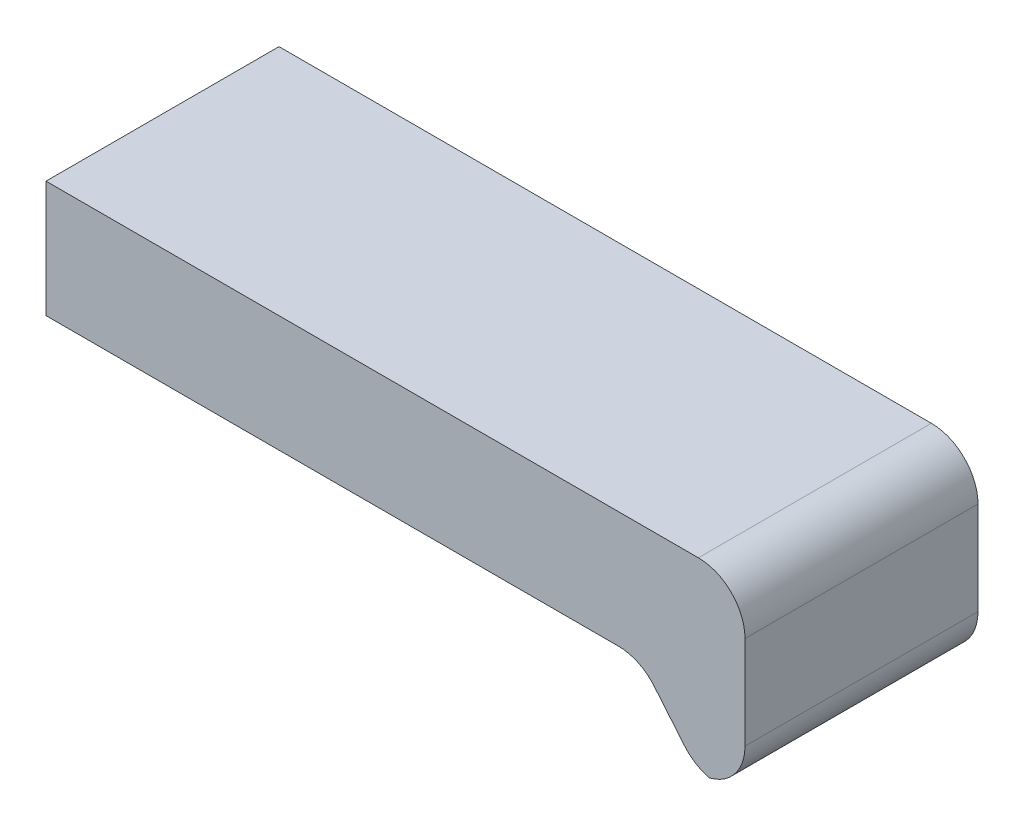
from build123d import *

# Parameters (mm, degrees)
BOSS_EXTRUDE1_DEPTH = 5
FILLET1_R           = 1


with BuildPart() as part:
    # Sketch1 → Boss-Extrude1 (new body)
    with BuildSketch(Plane.XY):
        Polygon((0, 2.5), (15, 2.5), (15, -1.5), (14, -1.5), (12.75, 0), (0, 0), align=None)
    extrude(amount=BOSS_EXTRUDE1_DEPTH)

    # Fillet1
    # the kernel refuses this fillet: 1 mm, written as the material it adds along each edge
    with BuildSketch(Plane(origin=(12.75, 0, 0), x_dir=(0.6401843996644788, -0.7682212795973767, 0), z_dir=(0, 0, 1))) as fillet1_piece_1:
        with BuildLine():
            CenterArc((FILLET1_R * 0.468374945984, -FILLET1_R), FILLET1_R, 90, 50.194428908)
            Line((-FILLET1_R * 0.299846333613, -FILLET1_R * 0.359815600336), (0, 0))
            Line((0, 0), (FILLET1_R * 0.468374945984, 0))
        make_face()
    extrude(amount=5)
    # the kernel refuses this fillet: 1 mm, written as the material it takes off along each edge
    with BuildSketch(Plane(origin=(15, 2.5, -2.5), x_dir=(-1, 0, 0), z_dir=(0, 0, 1)), Plane(origin=(15, -1.5, -2.5), x_dir=(0, 1, 0), z_dir=(0, 0, 1))) as fillet1_2_piece_1:
        with BuildLine():
            CenterArc((FILLET1_R, FILLET1_R), FILLET1_R, 180, 90)
            Line((0, FILLET1_R), (0, 0))
            Line((0, 0), (FILLET1_R, 0))
        make_face()
    extrude(amount=10, mode=Mode.SUBTRACT)
    with BuildSketch(Plane(origin=(14, -1.5, -1.170937365), x_dir=(1, 0, 0), z_dir=(0, 0, 1))) as fillet1_2_piece_2:
        with BuildLine():
            CenterArc((FILLET1_R * 0.468374945984, FILLET1_R), FILLET1_R, 219.805571092, 50.194428908)
            Line((-FILLET1_R * 0.299846333613, FILLET1_R * 0.359815600336), (0, 0))
            Line((0, 0), (FILLET1_R * 0.468374945984, 0))
        make_face()
    extrude(amount=7.34187473, mode=Mode.SUBTRACT)


solid = part.part
